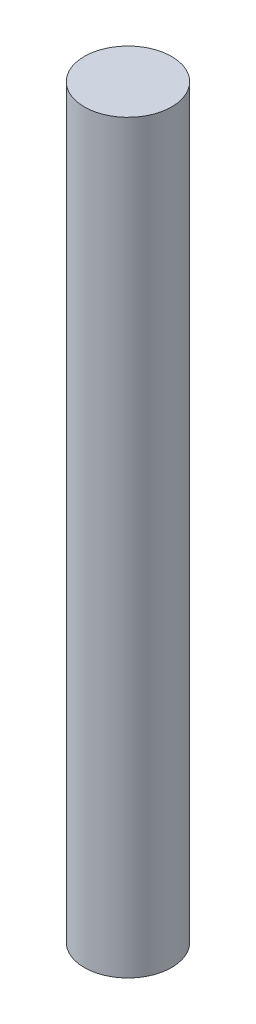
from build123d import *

# Parameters (mm, degrees)
SKETCH1_R           = 3.96875
BOSS_EXTRUDE1_DEPTH = 67.733333333
SCALE1_SCALE        = 0.75


with BuildPart() as part:
    # Sketch1 → Boss-Extrude1 (new body)
    with BuildSketch(Plane(origin=(0, 0, 0), x_dir=(1, 0, 0), z_dir=(0, 1, 0))):
        Circle(SKETCH1_R)
    extrude(amount=BOSS_EXTRUDE1_DEPTH)


with BuildPart() as part_1:
    # Scale1: scaled about (0, 33.866666667, 0)
    add(part.part.scale(SCALE1_SCALE).moved(Location((0, 8.466666667, 0))))


solid = part_1.part
